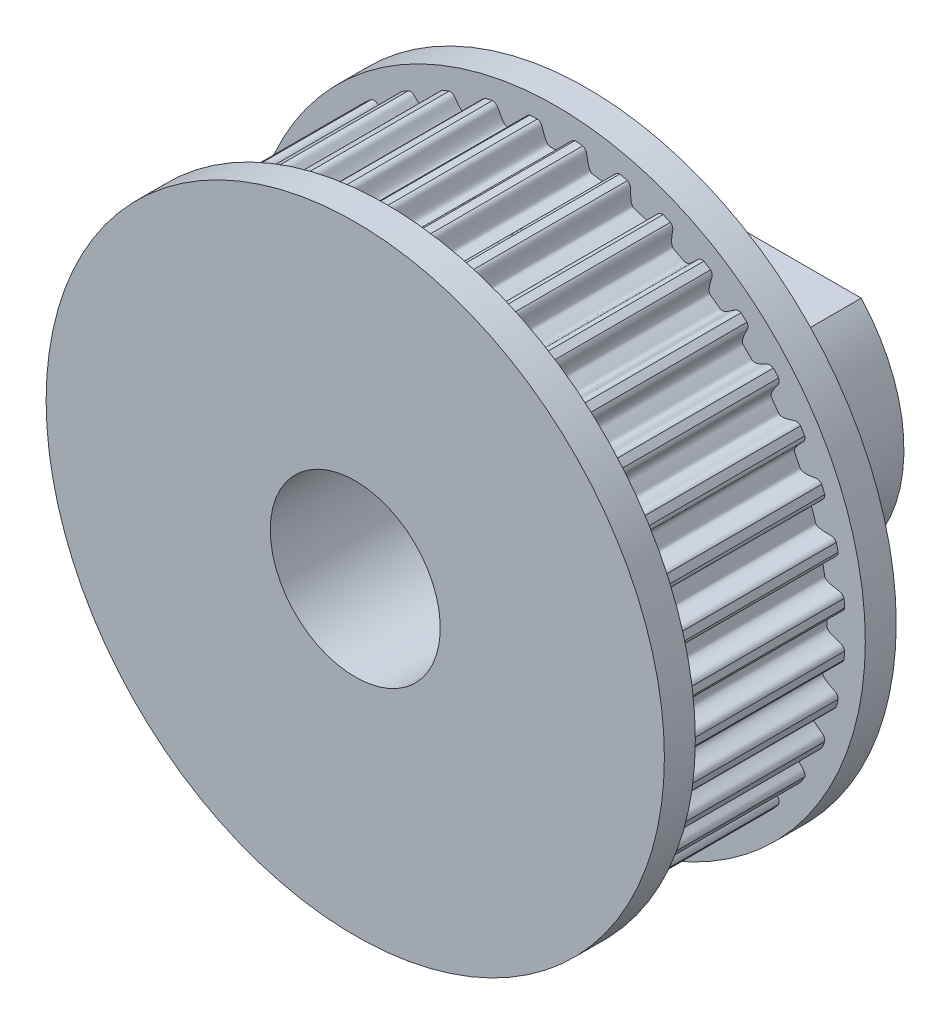
from build123d import *

# Parameters (mm, degrees)
TOOTHEXTRUDECUTGEARBELT01_DEPTH = 8.249999876
TOOTH_PATTERN_40_COUNT          = 40
BOREREVOLVESKETCH_W             = 19.547999706
BOREREVOLVESKETCH_H             = 5
SKETCH_5_R                      = 25.4300037
CUT_EXTRUDE_2_DEPTH             = 4.55
SKETCH_6_R                      = 21.993563516
CUT_EXTRUDE_3_DEPTH             = 4
SKETCH_7_R                      = 20
EXTRUDE_1_DEPTH                 = 2
EXTRUDE_START                   = 2
SKETCH_8_R                      = 20
EXTRUDE_2_DEPTH                 = 2
SKETCH_9_R                      = 5.5
CUT_EXTRUDE_5_DEPTH             = 2
SKETCH_10_R                     = 5.5
CUT_EXTRUDE_6_DEPTH             = 33.014684181
SKETCH_11_R                     = 10.5
SKETCH_11_R_2                   = 3.25
EXTRUDE_4_DEPTH                 = 10
EXTRUDE_START_2                 = -10
EXTRUDE_5_DEPTH                 = 10
CUT_EXTRUDE_START               = -10
CUT_EXTRUDE_7_DEPTH             = 10
CUT_EXTRUDE_9_REACH             = 40.083
SKETCH_15_R                     = 1.6
FILLET_2_R                      = 2


with BuildPart() as part:
    # SketchRevolveGearBelt01 → Gates_PowerGrip_GT_3mm, 15mm Belt Width (revolve)
    with BuildSketch(Plane(origin=(0, 0, 0), x_dir=(0, 0, -1), z_dir=(1, 0, 0))):
        Polygon((9.773999853, 0), (9.773999853, 16.69859292), (9.011999865, 16.69859292), (9.011999865, 18.947021663), (9.480047286, 20.076988094), (8.776051092, 20.368592865), (8.249999876, 19.098592884), (8.249999876, 18.70362289), (-8.249999876, 18.70362289), (-8.249999876, 19.098592884), (-8.776051092, 20.368592865), (-9.480047286, 20.076988094), (-9.011999865, 18.947021663), (-9.011999865, 16.69859292), (-9.773999853, 16.69859292), (-9.773999853, 0), align=None)
    revolve(axis=Axis((0, 0, 0), (0, 0, -1)))

    # SketchToothGearBelt01 → ToothExtrudeCutGearBelt01 (cut, symmetric)
    with BuildSketch(Plane.XY):
        with BuildLine():
            ThreePointArc((18.672029296, 1.292480941), (18.716708712, 0), (18.672029296, -1.292480941))
            add(Edge.make_bspline(
                [(18.672029296, -1.292480941), (18.672126883, -1.266495082), (18.668449647, -1.227504748), (18.656079537, -1.176963482), (18.64315845, -1.14013992), (18.626715904, -1.104748209), (18.606908087, -1.071124052), (18.583922791, -1.039586823), (18.557978522, -1.010434495), (18.529319926, -0.983948371), (18.498224591, -0.960362224), (18.464966401, -0.939965278), (18.429939869, -0.922706867), (18.371348429, -0.901913328), (18.296412546, -0.879257474), (18.207760445, -0.851216557), (18.129086597, -0.824734617), (18.055167634, -0.798276305), (17.986011718, -0.771816005), (17.921615219, -0.745360204), (17.861976945, -0.718907351), (17.807094501, -0.692457579), (17.756965022, -0.666010094), (17.711584766, -0.639563429), (17.670949195, -0.613114736), (17.635052568, -0.586658928), (17.603889933, -0.560187301), (17.577453957, -0.533685798), (17.555754325, -0.507133275), (17.538773262, -0.480502635), (17.526644512, -0.453766913), (17.519083406, -0.426922601), (17.515781556, -0.375466934), (17.520554932, -0.299989788), (17.520771013, -0.19995905), (17.521923806, -0.099984782), (17.522094913, 0), (17.521923806, 0.099984782), (17.520771013, 0.19995905), (17.520554932, 0.299989788), (17.515781556, 0.375466934), (17.519083406, 0.426922601), (17.526644512, 0.453766913), (17.538773262, 0.480502635), (17.555754325, 0.507133275), (17.577453957, 0.533685798), (17.603889933, 0.560187301), (17.635052568, 0.586658928), (17.670949195, 0.613114736), (17.711584766, 0.639563429), (17.756965022, 0.666010094), (17.807094501, 0.692457579), (17.861976945, 0.718907351), (17.921615219, 0.745360204), (17.986011718, 0.771816005), (18.055167634, 0.798276305), (18.129086597, 0.824734617), (18.207760445, 0.851216557), (18.296412546, 0.879257474), (18.371348429, 0.901913328), (18.429939869, 0.922706867), (18.464966401, 0.939965278), (18.498224591, 0.960362224), (18.529319926, 0.983948371), (18.557978522, 1.010434495), (18.583922791, 1.039586823), (18.606908087, 1.071124052), (18.626715904, 1.104748209), (18.64315845, 1.14013992), (18.656079537, 1.176963482), (18.668449647, 1.227504748), (18.672126883, 1.266495082), (18.672029296, 1.292480941)],
                knots=[0, 0, 0, 0, 0.019855995, 0.029783993, 0.03971199, 0.049639988, 0.059567985, 0.069495983, 0.07942398, 0.089351978, 0.099279975, 0.109207973, 0.11913597, 0.129063968, 0.156684055, 0.178986737, 0.200134998, 0.220135968, 0.238998082, 0.256731398, 0.273348025, 0.288862686, 0.303293478, 0.3166629, 0.328999259, 0.340338602, 0.35072736, 0.360225913, 0.368913222, 0.376892371, 0.384296081, 0.39128991, 0.398069514, 0.423571008, 0.449047338, 0.474523669, 0.5, 0.525476331, 0.550952662, 0.576428992, 0.601930486, 0.60871009, 0.615703919, 0.623107629, 0.631086778, 0.639774087, 0.64927264, 0.659661398, 0.671000741, 0.6833371, 0.696706522, 0.711137314, 0.726651975, 0.743268602, 0.761001918, 0.779864032, 0.799865002, 0.821013263, 0.843315945, 0.870936032, 0.88086403, 0.890792027, 0.900720025, 0.910648022, 0.92057602, 0.930504017, 0.940432015, 0.950360012, 0.96028801, 0.970216007, 0.980144005, 1, 1, 1, 1], degree=3))
        make_face()
    toothextrudecutgearbelt01 = extrude(amount=TOOTHEXTRUDECUTGEARBELT01_DEPTH, both=True, mode=Mode.SUBTRACT)

    # Tooth Pattern, 40: ToothExtrudeCutGearBelt01 ×40 about axis
    tooth_pattern_40_axis = Axis((0, 0, 55), (0, 0, -1))
    for i in range(1, TOOTH_PATTERN_40_COUNT):
        add(toothextrudecutgearbelt01.rotate(tooth_pattern_40_axis, i * 360 / TOOTH_PATTERN_40_COUNT), mode=Mode.SUBTRACT)

    # BoreRevolveSketch → BoreRevolveCut (revolve, cut)
    with BuildSketch(Plane(origin=(0, 0, 0), x_dir=(0, 0, -1), z_dir=(1, 0, 0))):
        with Locations((0, 2.5)):
            Rectangle(BOREREVOLVESKETCH_W, BOREREVOLVESKETCH_H)
    revolve(axis=Axis((0, 0, 0), (0, 0, -1)), mode=Mode.SUBTRACT)

    # 草图5 → 切除-拉伸2 (cut)
    with BuildSketch(Plane.XY.offset(9.773999853)):
        Circle(SKETCH_5_R)
    extrude(amount=-CUT_EXTRUDE_2_DEPTH, mode=Mode.SUBTRACT)

    # 草图6 → 切除-拉伸3 (cut)
    with BuildSketch(Plane(origin=(0, 0, -9.773999853), x_dir=(-1, 0, 0), z_dir=(0, 0, -1))):
        Circle(SKETCH_6_R)
    extrude(amount=-CUT_EXTRUDE_3_DEPTH, mode=Mode.SUBTRACT)

    # 草图7 → 凸台-拉伸1 (add)
    with BuildSketch(Plane.XY.offset(5.223999853)):
        Circle(SKETCH_7_R)
    extrude(amount=EXTRUDE_1_DEPTH)

    # 草图8 → 凸台-拉伸2 (add)
    with BuildSketch(Plane(origin=(0, 0, -5.773999853), x_dir=(-1, 0, 0), z_dir=(0, 0, -1)).offset(EXTRUDE_START)):
        Circle(SKETCH_8_R)
    extrude(amount=-EXTRUDE_2_DEPTH)

    # 草图9 → 切除-拉伸5 (cut)
    with BuildSketch(Plane(origin=(0, 0, -7.773999853), x_dir=(-1, 0, 0), z_dir=(0, 0, -1))):
        Circle(SKETCH_9_R)
    extrude(amount=-CUT_EXTRUDE_5_DEPTH, mode=Mode.SUBTRACT)

    # 草图10 → 切除-拉伸6 (cut, through all)
    with BuildSketch(Plane(origin=(0, 0, -7.773999853), x_dir=(-1, 0, 0), z_dir=(0, 0, -1))):
        Circle(SKETCH_10_R)
    extrude(amount=-CUT_EXTRUDE_6_DEPTH, mode=Mode.SUBTRACT)

    # 草图11 → 凸台-拉伸4 (add)
    with BuildSketch(Plane(origin=(0, 0, -7.773999853), x_dir=(-1, 0, 0), z_dir=(0, 0, -1))):
        Circle(SKETCH_11_R)
        Circle(SKETCH_11_R_2, mode=Mode.SUBTRACT)
    extrude(amount=EXTRUDE_4_DEPTH)

    # 草图13 → 凸台-拉伸5 (add)
    with BuildSketch(Plane(origin=(0, 0, -17.773999853), x_dir=(-1, 0, 0), z_dir=(0, 0, -1)).offset(EXTRUDE_START_2)):
        with BuildLine():
            ThreePointArc((2.480423351, 2.1), (0, 3.25), (-2.480423351, 2.1))
            Line((-2.480423351, 2.1), (0, 2.1))
            Line((0, 2.1), (2.480423351, 2.1))
        make_face()
    extrude(amount=EXTRUDE_5_DEPTH)

    # 草图14 → 切除-拉伸7 (cut)
    with BuildSketch(Plane(origin=(0, 0, -17.773999853), x_dir=(-1, 0, 0), z_dir=(0, 0, -1)).offset(CUT_EXTRUDE_START)):
        with BuildLine():
            Line((-7.735631842, 7.1), (-2.480423351, 7.1))
            Line((-2.480423351, 7.1), (2.480423351, 7.1))
            Line((2.480423351, 7.1), (7.735631842, 7.1))
            ThreePointArc((7.735631842, 7.1), (0, 10.5), (-7.735631842, 7.1))
        make_face()
    extrude(amount=CUT_EXTRUDE_7_DEPTH, mode=Mode.SUBTRACT)

    # 草图15 → 切除-拉伸9 (cut, up to next)
    with BuildSketch(Plane(origin=(0, 7.1, 0), x_dir=(1, 0, 0), z_dir=(0, 1, 0)), mode=Mode.PRIVATE) as cut_extrude_9_sk1:
        with Locations((0, 12.773999853)):
            Circle(SKETCH_15_R)
    cut_extrude_9_tool1 = extrude(cut_extrude_9_sk1.sketch, amount=-CUT_EXTRUDE_9_REACH, mode=Mode.PRIVATE) & part.part
    add(cut_extrude_9_tool1.solids().sort_by_distance((0, 7.1, -12.774))[0], mode=Mode.SUBTRACT)

    # 圆角2
    fillet_2_edges = [part.edges().sort_by_distance(p)[0] for p in [
        (0, 7.1, -7.773999853),
        (0, -10.5, -7.773999853),
    ]]
    fillet(fillet_2_edges, radius=FILLET_2_R)


solid = part.part
